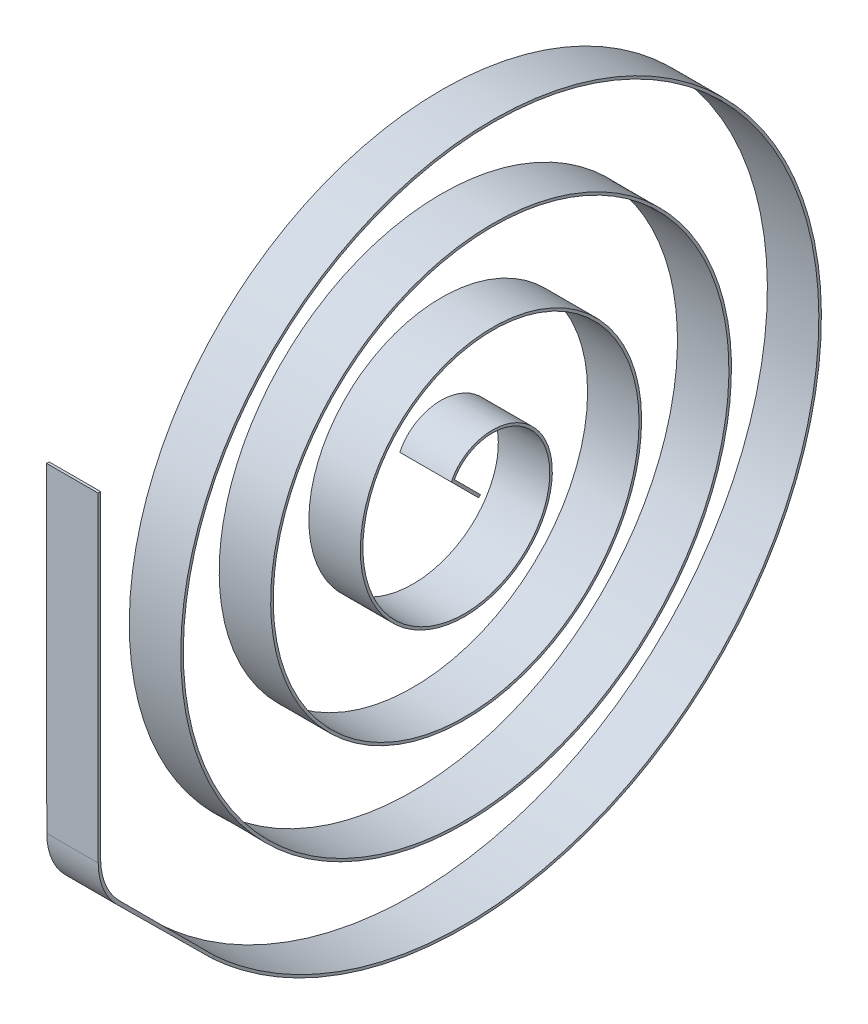
from build123d import *
from OCP.BRepAlgoAPI import BRepAlgoAPI_Cut
from OCP.TopTools import TopTools_ListOfShape

# Parameters (mm, degrees)
EXTRUDE_1_DEPTH     = 4
CUT_EXTRUDE_3_DEPTH = 4
EXTRUDE_2_DEPTH     = 4
EXTRUDE_3_DEPTH     = 4
FILLET_1_R          = 5


with BuildPart() as part:
    # 拉伸-薄壁1: read off the stored shape, not the designer's step
    # 拉伸-薄壁1 outline → 拉伸-薄壁1 (new body)
    with BuildSketch(Plane(origin=(0, 0, 0), x_dir=(0, 0, -1), z_dir=(1, 0, 0))):
        with BuildLine():
            Line((0.141421356, 0.141421356), (-1.878840746, 2.161683459))
            add(Edge.make_bspline(
                [(-1.878840746, 2.161683459), (-1.695711413, 2.511845792), (-1.422039799, 2.846571952), (-0.709175263, 3.395357168), (-0.270841075, 3.610130798), (0.712061055, 3.841875325), (1.2560811, 3.859917227), (2.357304517, 3.651661574), (2.914425272, 3.426653353), (3.930793584, 2.730106977), (4.390511151, 2.259868808), (5.103901348, 1.120890789), (5.358586917, 0.453220444), (5.578869071, -0.98608986), (5.545904575, -1.757118506), (5.152308415, -3.275377777), (4.793329515, -4.022621833), (3.766072885, -5.353271831), (3.099387003, -5.937382603), (1.534759379, -6.814685911), (0.638058515, -7.109219831), (-1.257152286, -7.318314573), (-2.255024227, -7.234677542), (-4.190278948, -6.656616557), (-5.127790874, -6.164182349), (-6.773356225, -4.807235744), (-7.482346503, -3.944573303), (-8.524825005, -1.955035503), (-8.859959404, -0.829544202), (-9.059527986, 1.52142157), (-8.926089544, 2.746244568), (-8.165290247, 5.099096924), (-7.54021307, 6.227364379), (-5.85501042, 8.189175642), (-4.796954921, 9.023861331), (-2.383339934, 10.233397511), (-1.029283397, 10.610155802), (1.777406531, 10.802339604), (3.229379309, 10.620165765), (6.000659493, 9.678675949), (7.32029589, 8.921886119), (9.59995131, 6.910033801), (10.561278453, 5.657219837), (11.940010311, 2.8204104), (12.359530407, 1.238013373), (12.546682088, -2.024409746), (12.316926704, -3.703766183), (11.196945665, -6.894400177), (10.309430844, -8.406072996), (7.97262415, -11.005292514), (6.525714557, -12.094266953), (3.266625807, -13.644456044), (1.456116917, -14.107931581), (-2.262061107, -14.292512112), (-4.169049118, -14.01637438), (-7.780006848, -12.720184226), (-9.484408675, -11.70296393), (-12.404973574, -9.042951233), (-13.622210216, -7.402576607), (-14.915911226, -4.642301978), (-15.259431618, -3.67315907), (-15.75192901, -1.672143214), (-15.901210838, -0.640362383), (-15.993933042, 1.44677504), (-15.937692294, 2.502103006), (-15.615979613, 4.595184553), (-15.350827341, 5.632974842), (-14.616152394, 7.649436843), (-14.146936746, 8.62820967), (-13.017263432, 10.486356287), (-12.357087166, 11.365891913), (-10.866572167, 12.988195079), (-10.036477205, 13.73117887), (-8.234510546, 15.047491174), (-7.262834509, 15.621081682), (-5.212442579, 16.571629829), (-4.133865732, 16.948884526), (-1.909526638, 17.486916959), (-0.763840683, 17.648014582), (1.551213153, 17.741988161), (2.720570995, 17.67519356), (5.037465635, 17.31040037), (6.185059336, 17.012727041), (8.412691155, 16.192283), (9.49285096, 15.66981975), (11.54146654, 14.414960867), (12.51010386, 13.682841998), (14.294907358, 12.032501029), (15.11130745, 11.11451337), (16.555950782, 9.12417815), (17.184470568, 8.052012867), (18.224283443, 5.791896672), (18.635884146, 4.604068253), (19.220708535, 2.156650954), (19.39425801, 0.897119708), (19.490764795, -1.645854929), (19.414052404, -2.929307847), (19.007436334, -5.470269691), (18.677853622, -6.727854734), (17.772825641, -9.167150909), (17.197678592, -10.34900133), (15.818701254, -12.588802289), (15.015134034, -13.646949171), (13.205875066, -15.595164199), (12.200400381, -16.485477198), (10.022410373, -18.059522914), (8.850057277, -18.743538407), (6.380708748, -19.873806709), (5.083814278, -20.32036805), (2.413569694, -20.953248984), (1.040255528, -21.139889656), (-1.730639947, -21.240219775), (-3.12825124, -21.154229189), (-5.893531613, -20.707056517), (-7.261294669, -20.346179776), (-9.912748507, -19.357761749), (-11.196592555, -18.730498425), (-13.628295583, -17.228478327), (-14.776359885, -16.353960677), (-16.888899328, -14.38669987), (-17.853622414, -13.294147355), (-19.558144863, -10.929223925), (-20.2982236, -9.656987747), (-21.520142179, -6.978905622), (-22.002280385, -5.573133626), (-22.684487592, -2.680318538), (-22.884860828, -1.193286469), (-22.990310356, 1.805525093), (-22.895683554, 3.317355823), (-22.409227108, 6.307202432), (-22.01767436, 7.785328389), (-20.947067128, 10.649430808), (-20.26825793, 12.0355702), (-18.644277895, 14.659890857), (-17.699310743, 15.898279645), (-15.574971359, 18.176056514), (-14.395753261, 19.215686587), (-11.844624638, 21.051761451), (-10.472813131, 21.848471205), (-7.586502579, 23.163237386), (-6.072044487, 23.681569413), (-2.956921497, 24.414376136), (-1.356239257, 24.629124499), (1.870478591, 24.740993933), (3.496587372, 24.638374514), (6.711243778, 24.113912307), (8.299915405, 23.692303571), (11.37715419, 22.540713744), (12.865888907, 21.810931385), (15.683540709, 20.066080408), (17.012659748, 19.05116724), (19.456586143, 16.770678914), (20.571619267, 15.505210212), (22.540322471, 12.768611002), (23.394230661, 11.297534737), (24.803043129, 8.203507108), (25.358186078, 6.580557176), (26.142867988, 3.243394678), (26.372634672, 1.529132745), (26.492227914, -1.925476362), (26.382260578, -3.665919222), (25.821074883, -7.105624489), (25.370031711, -8.805022209), (24.138670871, -12.095881515), (23.358489986, -13.687509504), (21.493862576, -16.699203314), (20.409509124, -18.119456708), (17.973807364, -20.730443132), (16.622505539, -21.921374138), (13.701176384, -24.023781101), (12.131148613, -24.935454386), (8.829921255, -26.439512433), (7.098676509, -27.032083132), (3.53974866, -27.869917584), (1.711980284, -28.115346015), (-1.970499721, -28.243969668), (-3.825330003, -28.127299843), (-7.490318466, -27.530676553), (-9.300620193, -27.0508217), (-12.805580207, -25.740905844), (-14.500397168, -24.910902704), (-17.70684077, -22.927598423), (-19.218630711, -21.77431244), (-21.997585582, -19.184338273), (-23.264907791, -17.747623143), (-25.502092911, -14.642310478), (-26.472096887, -12.973647026), (-28.072599874, -9.465743155), (-28.703214583, -7.626403349), (-29.595480088, -3.845990045), (-29.857213633, -1.904791264), (-29.996176501, 2.005533868), (-29.87345007, 3.974802164), (-29.242678243, 7.865303262), (-28.734635421, 9.786684287), (-27.34738456, 13.506220985), (-26.468136863, 15.304520213), (-24.367259999, 18.706418016), (-23.14555173, 20.310143906), (-21.773900947, 21.784059251)],
                knots=[0, 0, 0, 0, 0.015625, 0.015625, 0.03125, 0.03125, 0.046875, 0.046875, 0.0625, 0.0625, 0.078125, 0.078125, 0.09375, 0.09375, 0.109375, 0.109375, 0.125, 0.125, 0.140625, 0.140625, 0.15625, 0.15625, 0.171875, 0.171875, 0.1875, 0.1875, 0.203125, 0.203125, 0.21875, 0.21875, 0.234375, 0.234375, 0.25, 0.25, 0.265625, 0.265625, 0.28125, 0.28125, 0.296875, 0.296875, 0.3125, 0.3125, 0.328125, 0.328125, 0.34375, 0.34375, 0.359375, 0.359375, 0.375, 0.375, 0.390625, 0.390625, 0.40625, 0.40625, 0.421875, 0.421875, 0.4375, 0.4375, 0.453125, 0.453125, 0.4609375, 0.4609375, 0.46875, 0.46875, 0.4765625, 0.4765625, 0.484375, 0.484375, 0.4921875, 0.4921875, 0.5, 0.5, 0.5078125, 0.5078125, 0.515625, 0.515625, 0.5234375, 0.5234375, 0.53125, 0.53125, 0.5390625, 0.5390625, 0.546875, 0.546875, 0.5546875, 0.5546875, 0.5625, 0.5625, 0.5703125, 0.5703125, 0.578125, 0.578125, 0.5859375, 0.5859375, 0.59375, 0.59375, 0.6015625, 0.6015625, 0.609375, 0.609375, 0.6171875, 0.6171875, 0.625, 0.625, 0.6328125, 0.6328125, 0.640625, 0.640625, 0.6484375, 0.6484375, 0.65625, 0.65625, 0.6640625, 0.6640625, 0.671875, 0.671875, 0.6796875, 0.6796875, 0.6875, 0.6875, 0.6953125, 0.6953125, 0.703125, 0.703125, 0.7109375, 0.7109375, 0.71875, 0.71875, 0.7265625, 0.7265625, 0.734375, 0.734375, 0.7421875, 0.7421875, 0.75, 0.75, 0.7578125, 0.7578125, 0.765625, 0.765625, 0.7734375, 0.7734375, 0.78125, 0.78125, 0.7890625, 0.7890625, 0.796875, 0.796875, 0.8046875, 0.8046875, 0.8125, 0.8125, 0.8203125, 0.8203125, 0.828125, 0.828125, 0.8359375, 0.8359375, 0.84375, 0.84375, 0.8515625, 0.8515625, 0.859375, 0.859375, 0.8671875, 0.8671875, 0.875, 0.875, 0.8828125, 0.8828125, 0.890625, 0.890625, 0.8984375, 0.8984375, 0.90625, 0.90625, 0.9140625, 0.9140625, 0.921875, 0.921875, 0.9296875, 0.9296875, 0.9375, 0.9375, 0.9453125, 0.9453125, 0.953125, 0.953125, 0.9609375, 0.9609375, 0.96875, 0.96875, 0.9765625, 0.9765625, 0.984375, 0.984375, 0.9921875, 0.9921875, 1, 1, 1, 1], degree=3))
            Line((-21.773900947, 21.784059251), (-21.920310217, 21.920310217))
            add(Edge.make_bspline(
                [(-2.121320344, 2.121320344), (-1.946759899, 2.502120266), (-1.675382244, 2.868908278), (-0.955566353, 3.482763508), (-0.507236314, 3.729166667), (0.507236314, 4.020833333), (1.072979751, 4.065524736), (2.227664853, 3.902936232), (2.815977181, 3.695297762), (3.90153724, 3.022216659), (4.398034458, 2.55671546), (5.187215692, 1.413625151), (5.479166667, 0.736310778), (5.770833333, -0.736310778), (5.76997692, -1.531038548), (5.432062411, -3.108998069), (5.094714737, -3.891433941), (4.097673419, -5.300954215), (3.438048676, -5.927160637), (1.871683948, -6.891667876), (0.965385243, -7.229166667), (-0.965385243, -7.520833333), (-1.989097346, -7.474429105), (-3.990331285, -6.961188591), (-4.966890701, -6.494131711), (-6.700371189, -5.173130179), (-7.456286817, -4.319381891), (-8.59612006, -2.329742746), (-8.979166667, -1.194459707), (-9.270833333, 1.194459707), (-9.178881289, 2.447156144), (-8.49031477, 4.8716645), (-7.893548685, 6.042347461), (-6.248586939, 8.099788163), (-5.200715107, 8.985412997), (-2.787801544, 10.300572245), (-1.423534171, 10.729166667), (1.423534171, 11.020833333), (2.905214941, 10.883333473), (5.752997716, 10.01944095), (7.117804221, 9.292965659), (9.499205137, 7.324043699), (10.514539176, 6.082048323), (12.005024429, 3.245860341), (12.479166667, 1.652608635), (12.770833333, -1.652608635), (12.587785657, -3.363273739), (11.54856713, -6.634330932), (10.692382633, -8.193260981), (8.399500459, -10.898622111), (6.963381538, -12.043665356), (3.703919139, -13.709476613), (1.8816831, -14.229166667), (-1.8816831, -14.520833333), (-3.821332537, -14.292237841), (-7.515664147, -13.077693309), (-9.268717741, -12.091799608), (-12.298039085, -9.474957219), (-13.572791535, -7.844714754), (-14.953644482, -5.082662141), (-15.325999225, -4.109988019), (-15.875232508, -2.09632285), (-16.052083333, -1.055378782), (-16.197916667, 1.055378782), (-16.166881158, 2.125140086), (-15.892537695, 4.251874815), (-15.649222391, 5.308792841), (-14.954287123, 7.367595856), (-14.502671029, 8.369424421), (-13.403527834, 10.276901525), (-12.756015931, 11.18249489), (-11.285614629, 12.85913567), (-10.4627514, 13.630131435), (-8.6696985, 15.003603338), (-7.699545161, 15.606033532), (-5.646539543, 16.614265165), (-4.563732514, 17.02002836), (-2.325394482, 17.613951854), (-1.169916014, 17.802083333), (1.169916014, 17.947916667), (2.354211718, 17.905600504), (4.70561931, 17.586566831), (5.872670243, 17.309843074), (8.143110467, 16.527244804), (9.246438101, 16.021376327), (11.34438366, 14.794966179), (12.338941704, 14.074442852), (14.177562591, 12.442061443), (15.02156978, 11.530233535), (16.522308637, 9.54671218), (17.178991212, 8.475059772), (18.274885848, 6.210416945), (18.714057495, 5.017477009), (19.3526712, 2.554466114), (19.552083333, 1.284453246), (19.697916667, -1.284453246), (19.64431985, -2.58328335), (19.280595966, -5.159363805), (18.970463757, -6.436547646), (18.100202485, -8.918625078), (17.540081625, -10.123451781), (16.186404524, -12.411865796), (15.392869772, -13.495388517), (13.598508256, -15.495989511), (12.597715671, -16.413008125), (10.42372586, -18.041013935), (9.250574383, -18.751948893), (6.774294347, -19.935506531), (5.471221504, -20.40808663), (2.783537746, -21.091390547), (1.398990479, -21.302083333), (-1.398990479, -21.447916667), (-2.812354982, -21.383039196), (-5.6131083, -20.974625101), (-7.000425048, -20.63108444), (-9.694139689, -19.673160165), (-11.00046546, -19.058786923), (-13.479347932, -17.577842869), (-14.651835331, -16.711296693), (-16.814416432, -14.75495507), (-17.80444647, -13.665197807), (-19.559719233, -11.300739539), (-20.324906574, -10.026088994), (-21.596127214, -7.338171749), (-22.102115766, -5.924965999), (-22.830109893, -3.012609378), (-23.052083333, -1.513527711), (-23.197916667, 1.513527711), (-23.121758543, 3.041426615), (-22.668654236, 6.066852795), (-22.291705123, 7.56430245), (-21.246117846, 10.4696543), (-20.577492222, 11.87747914), (-18.969281213, 14.546830068), (-18.029723614, 15.808282144), (-15.911401883, 18.132843352), (-14.732679943, 19.195884814), (-12.177753219, 21.078424531), (-10.801603605, 21.897864255), (-7.902049152, 23.256747897), (-6.378710494, 23.796144901), (-3.241681011, 24.568829239), (-1.628064943, 24.802083333), (1.628064943, 24.947916667), (3.270498247, 24.860477889), (6.52059729, 24.362683371), (8.128179852, 23.952325807), (11.245168911, 22.819075527), (12.75449282, 22.09619752), (15.614312204, 20.360719558), (16.964728958, 19.348150534), (19.451270273, 17.067848697), (20.587323159, 15.800162079), (22.59712983, 13.054766899), (23.470821935, 11.577118216), (24.91736858, 8.465926554), (25.490174036, 6.832454989), (26.307548585, 3.470752643), (26.552083333, 1.742602175), (26.697916667, -1.742602175), (26.599197235, -3.499569879), (26.056712507, -6.974341784), (25.61294649, -8.692057254), (24.392033208, -12.020683523), (23.614902818, -13.6315065), (21.752157903, -16.681794339), (20.666577455, -18.121175772), (18.22429551, -20.769697194), (16.867644214, -21.978761504), (13.931780579, -24.115835128), (12.352632828, -25.043779616), (9.029803956, -26.577989263), (7.286199484, -27.184203171), (3.699824275, -28.046267932), (1.857139407, -28.302083333), (-1.857139407, -28.447916667), (-3.728641511, -28.337916581), (-7.428086279, -27.750741642), (-9.255934656, -27.273567173), (-12.796198134, -25.964990888), (-14.508520179, -25.133608117), (-17.749276475, -23.143596248), (-19.277622585, -21.985004375), (-22.088124114, -19.380742324), (-23.370199849, -17.93512635), (-25.634540426, -14.808794258), (-26.616737297, -13.128147439), (-28.238609946, -9.593681358), (-28.878232306, -7.739943978), (-29.784987278, -3.928895907), (-30.052083333, -1.971676639), (-30.197916667, 1.971676639), (-30.076635928, 3.957713143), (-29.444770777, 7.881830774), (-28.934187856, 9.819812058), (-27.537948569, 13.571712745), (-26.652313415, 15.385533859), (-24.535034592, 18.816758611), (-23.303431296, 20.434069399), (-21.920310217, 21.920310217)],
                knots=[0, 0, 0, 0, 0.015625, 0.015625, 0.03125, 0.03125, 0.046875, 0.046875, 0.0625, 0.0625, 0.078125, 0.078125, 0.09375, 0.09375, 0.109375, 0.109375, 0.125, 0.125, 0.140625, 0.140625, 0.15625, 0.15625, 0.171875, 0.171875, 0.1875, 0.1875, 0.203125, 0.203125, 0.21875, 0.21875, 0.234375, 0.234375, 0.25, 0.25, 0.265625, 0.265625, 0.28125, 0.28125, 0.296875, 0.296875, 0.3125, 0.3125, 0.328125, 0.328125, 0.34375, 0.34375, 0.359375, 0.359375, 0.375, 0.375, 0.390625, 0.390625, 0.40625, 0.40625, 0.421875, 0.421875, 0.4375, 0.4375, 0.453125, 0.453125, 0.4609375, 0.4609375, 0.46875, 0.46875, 0.4765625, 0.4765625, 0.484375, 0.484375, 0.4921875, 0.4921875, 0.5, 0.5, 0.5078125, 0.5078125, 0.515625, 0.515625, 0.5234375, 0.5234375, 0.53125, 0.53125, 0.5390625, 0.5390625, 0.546875, 0.546875, 0.5546875, 0.5546875, 0.5625, 0.5625, 0.5703125, 0.5703125, 0.578125, 0.578125, 0.5859375, 0.5859375, 0.59375, 0.59375, 0.6015625, 0.6015625, 0.609375, 0.609375, 0.6171875, 0.6171875, 0.625, 0.625, 0.6328125, 0.6328125, 0.640625, 0.640625, 0.6484375, 0.6484375, 0.65625, 0.65625, 0.6640625, 0.6640625, 0.671875, 0.671875, 0.6796875, 0.6796875, 0.6875, 0.6875, 0.6953125, 0.6953125, 0.703125, 0.703125, 0.7109375, 0.7109375, 0.71875, 0.71875, 0.7265625, 0.7265625, 0.734375, 0.734375, 0.7421875, 0.7421875, 0.75, 0.75, 0.7578125, 0.7578125, 0.765625, 0.765625, 0.7734375, 0.7734375, 0.78125, 0.78125, 0.7890625, 0.7890625, 0.796875, 0.796875, 0.8046875, 0.8046875, 0.8125, 0.8125, 0.8203125, 0.8203125, 0.828125, 0.828125, 0.8359375, 0.8359375, 0.84375, 0.84375, 0.8515625, 0.8515625, 0.859375, 0.859375, 0.8671875, 0.8671875, 0.875, 0.875, 0.8828125, 0.8828125, 0.890625, 0.890625, 0.8984375, 0.8984375, 0.90625, 0.90625, 0.9140625, 0.9140625, 0.921875, 0.921875, 0.9296875, 0.9296875, 0.9375, 0.9375, 0.9453125, 0.9453125, 0.953125, 0.953125, 0.9609375, 0.9609375, 0.96875, 0.96875, 0.9765625, 0.9765625, 0.984375, 0.984375, 0.9921875, 0.9921875, 1, 1, 1, 1], degree=3))
            Line((-2.121320344, 2.121320344), (0, 0))
            Line((0, 0), (0.141421356, 0.141421356))
        make_face()
    extrude(amount=EXTRUDE_1_DEPTH)


with BuildPart() as cut_extrude_3_tool:
    # 草图9 → 切除-拉伸3 (new body)
    with BuildSketch(Plane.ZY):
        Polygon((20.541348706, -20.541348706), (20.752762633, -20.752762633), (33.008275053, -8.497250213), (30.770717628, 20.6448695), (22.273628879, 24.965423101), (18.997209065, 21.689003287), (26.880518843, 1.850461334), align=None)
    extrude(amount=-CUT_EXTRUDE_3_DEPTH)


with BuildPart() as part_1:
    add(part.part)

    # 切除-拉伸3: cut by cut_extrude_3_tool, with a tolerance
    cut_extrude_3_stock = TopTools_ListOfShape()
    cut_extrude_3_stock.Append(part_1.part.wrapped)
    cut_extrude_3_tools = TopTools_ListOfShape()
    cut_extrude_3_tools.Append(cut_extrude_3_tool.part.wrapped)
    cut_extrude_3_cut = BRepAlgoAPI_Cut()
    cut_extrude_3_cut.SetArguments(cut_extrude_3_stock)
    cut_extrude_3_cut.SetTools(cut_extrude_3_tools)
    cut_extrude_3_cut.SetFuzzyValue(0.00001)
    cut_extrude_3_cut.Build()
    add(Compound.cast(cut_extrude_3_cut.Shape()).solids(), mode=Mode.REPLACE)


with BuildPart() as body_2:
    # 草图11 → 凸台-拉伸2 (new body)
    with BuildSketch(Plane.ZY):
        Polygon((20.54134865, -20.541348758), (29.380068035, -11.702622645), (29.566091915, -11.888646384), (20.682873351, -20.682873351), align=None)
    extrude(amount=-EXTRUDE_2_DEPTH)

    # 草图12 → 凸台-拉伸3 (add)
    with BuildSketch(Plane.ZY):
        Polygon((29.380068035, -11.702622645), (29.380068035, 15.111353616), (29.580068035, 15.111353616), (29.566091915, -11.888646384), align=None)
    extrude(amount=-EXTRUDE_3_DEPTH)

    # 圆角1
    fillet_1_edges = [body_2.edges().sort_by_distance(p)[0] for p in [
        (2, -11.702622645, 29.380068035),
        (2, -11.888646384, 29.566091915),
    ]]
    fillet(fillet_1_edges, radius=FILLET_1_R)


solid = Compound([part_1.part, body_2.part])
